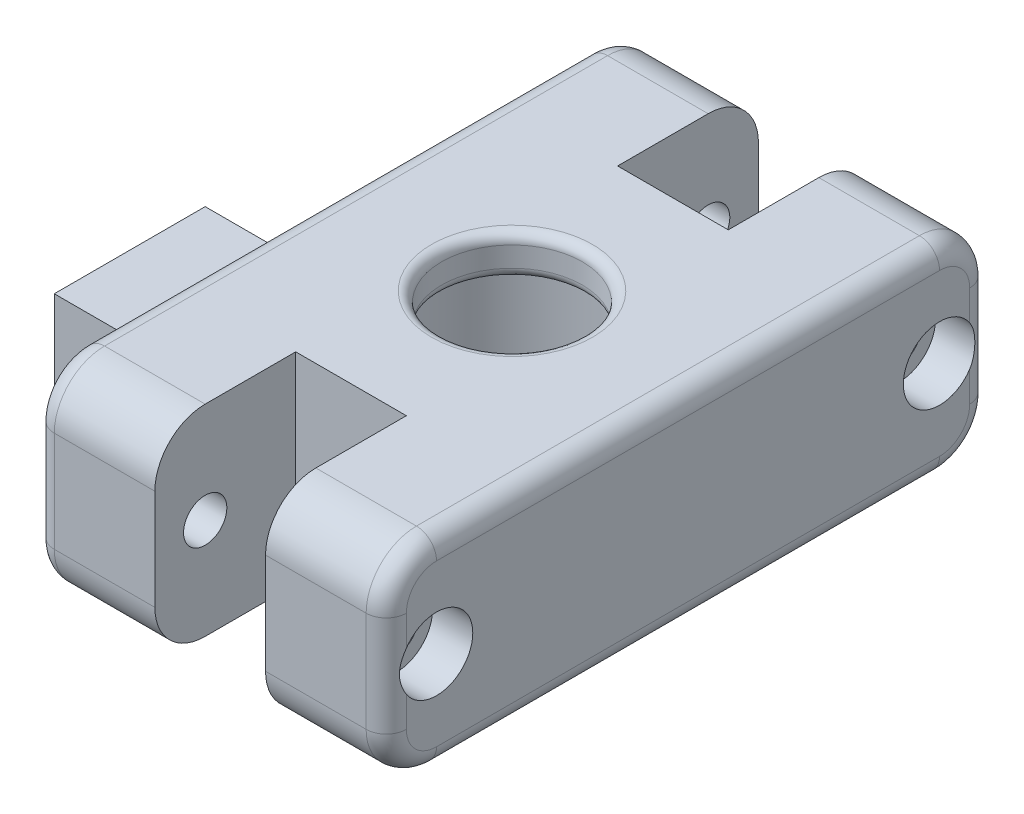
from build123d import *

# Parameters (mm, degrees)
SKETCH1_W           = 35
SKETCH1_H           = 60
BOSS_EXTRUDE1_DEPTH = 20
SKETCH2_R           = 10
CUT_EXTRUDE1_DEPTH  = 16
SKETCH4_R           = 7
CUT_EXTRUDE2_DEPTH  = 42.997755111
FILLET1_R           = 2
SKETCH5_W           = 11
SKETCH5_H           = 14
CUT_EXTRUDE3_DEPTH  = 44.678500826
SKETCH6_R           = 2.15
CUT_EXTRUDE4_DEPTH  = 53.234749007
FILLET3_R           = 5
FILLET4_R           = 5
FILLET7_R           = 1
SKETCH7_W           = 15
SKETCH7_H           = 16
BOSS_EXTRUDE2_DEPTH = 7
SKETCH8_R           = 1.75
CUT_EXTRUDE5_DEPTH  = 15
SKETCH9_R           = 3.6
CUT_EXTRUDE6_DEPTH  = 4
CUT_EXTRUDE7_DEPTH  = 3


with BuildPart() as part:
    # Sketch1 → Boss-Extrude1 (new body)
    with BuildSketch(Plane(origin=(0, 0, 0), x_dir=(1, 0, 0), z_dir=(0, 1, 0))):
        with Locations((-2.608267717, 3.218503937)):
            Rectangle(SKETCH1_W, SKETCH1_H)
    extrude(amount=BOSS_EXTRUDE1_DEPTH)

    # Sketch2 → Cut-Extrude1 (cut)
    with BuildSketch(Plane.XZ):
        with Locations(Location((-2.608267717, -3.218503937, 0), (0, 0, 270))):
            Circle(SKETCH2_R)
    extrude(amount=-CUT_EXTRUDE1_DEPTH, mode=Mode.SUBTRACT)

    # Sketch4 → Cut-Extrude2 (cut, through all)
    with BuildSketch(Plane.XZ.offset(-16)):
        with Locations(Location((-2.608267717, -3.218503937, 0), (0, 0, 270))):
            Circle(SKETCH4_R)
    extrude(amount=-CUT_EXTRUDE2_DEPTH, mode=Mode.SUBTRACT)

    # Fillet1
    fillet1_edges = [part.edges().sort_by_distance(p)[0] for p in [
        (-20.108267717, 20, -3.218503937),
        (14.891732283, 20, -3.218503937),
        (-20.108267717, 0, -3.218503937),
        (14.891732283, 0, -3.218503937),
        (14.891732283, 10, 26.781496063),
        (-20.108267717, 10, 26.781496063),
        (-20.108267717, 10, -33.218503937),
        (14.891732283, 10, -33.218503937),
    ]]
    fillet(fillet1_edges, radius=FILLET1_R)

    # Sketch5 → Cut-Extrude3 (cut, through all)
    with BuildSketch(Plane.XZ):
        with Locations((-2.608267717, 19.781496063)):
            Rectangle(SKETCH5_W, SKETCH5_H)
        with Locations((-2.608267717, -26.218503937)):
            Rectangle(SKETCH5_W, SKETCH5_H)
    extrude(amount=-CUT_EXTRUDE3_DEPTH, mode=Mode.SUBTRACT)

    # Sketch6 → Cut-Extrude4 (cut, through all)
    with BuildSketch(Plane.ZY.offset(20.108267717)):
        with Locations((-28.218503937, 10)):
            Circle(SKETCH6_R)
        with Locations((21.781496063, 10)):
            Circle(SKETCH6_R)
    extrude(amount=-CUT_EXTRUDE4_DEPTH, mode=Mode.SUBTRACT)

    # Fillet3
    # the kernel refuses this fillet: 5 mm, written as the material it takes off along each edge
    with BuildSketch(Plane(origin=(-20.108267717, 15, 21.781496063), x_dir=(0, 0, 1), z_dir=(0, -1, 0))) as fillet3_piece_1:
        with BuildLine():
            CenterArc((3, -2), 2, 0, 90)
            Line((5, -2), (5, 0))
            Line((5, 0), (3, 0))
        make_face()
    revolve(axis=Axis((-20.108267717, 15, 21.781496063), (-1, 0, 0)), revolution_arc=90, mode=Mode.SUBTRACT)
    with BuildSketch(Plane(origin=(-20.108267717, 5, 21.781496063), x_dir=(0, -1, 0), z_dir=(0, 0, -1))) as fillet3_piece_2:
        with BuildLine():
            CenterArc((3, -2), 2, 0, 90)
            Line((5, -2), (5, 0))
            Line((5, 0), (3, 0))
        make_face()
    revolve(axis=Axis((-20.108267717, 5, 21.781496063), (-1, 0, 0)), revolution_arc=90, mode=Mode.SUBTRACT)
    with BuildSketch(Plane(origin=(14.891732283, 15, 21.781496063), x_dir=(0, 1, 0), z_dir=(0, 0, -1))) as fillet3_piece_3:
        with BuildLine():
            CenterArc((3, -2), 2, 0, 90)
            Line((5, -2), (5, 0))
            Line((5, 0), (3, 0))
        make_face()
    revolve(axis=Axis((14.891732283, 15, 21.781496063), (1, 0, 0)), revolution_arc=90, mode=Mode.SUBTRACT)
    with BuildSketch(Plane(origin=(14.891732283, 5, 21.781496063), x_dir=(0, 0, 1), z_dir=(0, 1, 0))) as fillet3_piece_4:
        with BuildLine():
            CenterArc((3, -2), 2, 0, 90)
            Line((5, -2), (5, 0))
            Line((5, 0), (3, 0))
        make_face()
    revolve(axis=Axis((14.891732283, 5, 21.781496063), (1, 0, 0)), revolution_arc=90, mode=Mode.SUBTRACT)
    with BuildSketch(Plane(origin=(4.391732283, 20, 26.781496063), x_dir=(0, 0, -1), z_dir=(-1, 0, 0)), Plane(origin=(14.891732283, 0, 26.781496063), x_dir=(0, 1, 0), z_dir=(-1, 0, 0))) as fillet3_piece_5:
        with BuildLine():
            CenterArc((FILLET3_R, FILLET3_R), FILLET3_R, 180, 90)
            Line((0, FILLET3_R), (0, 0))
            Line((0, 0), (FILLET3_R, 0))
        make_face()
    extrude(amount=24.5, mode=Mode.SUBTRACT)
    with BuildSketch(Plane(origin=(4.391732283, 0, 26.781496063), x_dir=(0, 0, -1), z_dir=(-1, 0, 0)), Plane(origin=(14.891732283, 20, 26.781496063), x_dir=(0, -1, 0), z_dir=(-1, 0, 0))) as fillet3_piece_6:
        with BuildLine():
            CenterArc((FILLET3_R, -FILLET3_R), FILLET3_R, 90, 90)
            Line((0, -FILLET3_R), (0, 0))
            Line((0, 0), (FILLET3_R, 0))
        make_face()
    extrude(amount=24.5, mode=Mode.SUBTRACT)

    # Fillet4
    # the kernel refuses this fillet: 5 mm, written as the material it takes off along each edge
    with BuildSketch(Plane(origin=(-20.108267717, 15, -28.218503937), x_dir=(0, 1, 0), z_dir=(0, 0, 1))) as fillet4_piece_1:
        with BuildLine():
            CenterArc((3, -2), 2, 0, 90)
            Line((5, -2), (5, 0))
            Line((5, 0), (3, 0))
        make_face()
    revolve(axis=Axis((-20.108267717, 15, -28.218503937), (-1, 0, 0)), revolution_arc=90, mode=Mode.SUBTRACT)
    with BuildSketch(Plane(origin=(-20.108267717, 5, -28.218503937), x_dir=(0, 0, -1), z_dir=(0, 1, 0))) as fillet4_piece_2:
        with BuildLine():
            CenterArc((3, -2), 2, 0, 90)
            Line((5, -2), (5, 0))
            Line((5, 0), (3, 0))
        make_face()
    revolve(axis=Axis((-20.108267717, 5, -28.218503937), (-1, 0, 0)), revolution_arc=90, mode=Mode.SUBTRACT)
    with BuildSketch(Plane(origin=(14.891732283, 15, -28.218503937), x_dir=(0, 0, -1), z_dir=(0, -1, 0))) as fillet4_piece_3:
        with BuildLine():
            CenterArc((3, -2), 2, 0, 90)
            Line((5, -2), (5, 0))
            Line((5, 0), (3, 0))
        make_face()
    revolve(axis=Axis((14.891732283, 15, -28.218503937), (1, 0, 0)), revolution_arc=90, mode=Mode.SUBTRACT)
    with BuildSketch(Plane(origin=(14.891732283, 5, -28.218503937), x_dir=(0, -1, 0), z_dir=(0, 0, 1))) as fillet4_piece_4:
        with BuildLine():
            CenterArc((3, -2), 2, 0, 90)
            Line((5, -2), (5, 0))
            Line((5, 0), (3, 0))
        make_face()
    revolve(axis=Axis((14.891732283, 5, -28.218503937), (1, 0, 0)), revolution_arc=90, mode=Mode.SUBTRACT)
    with BuildSketch(Plane(origin=(-9.608267717, 0, -33.218503937), x_dir=(0, 1, 0), z_dir=(1, 0, 0)), Plane(origin=(-20.108267717, 0, -33.218503937), x_dir=(0, 1, 0), z_dir=(1, 0, 0))) as fillet4_piece_5:
        with BuildLine():
            CenterArc((FILLET4_R, FILLET4_R), FILLET4_R, 180, 90)
            Line((0, FILLET4_R), (0, 0))
            Line((0, 0), (FILLET4_R, 0))
        make_face()
    extrude(amount=24.5, mode=Mode.SUBTRACT)
    with BuildSketch(Plane(origin=(-9.608267717, 20, -33.218503937), x_dir=(0, -1, 0), z_dir=(1, 0, 0)), Plane(origin=(-20.108267717, 20, -33.218503937), x_dir=(0, -1, 0), z_dir=(1, 0, 0))) as fillet4_piece_6:
        with BuildLine():
            CenterArc((FILLET4_R, -FILLET4_R), FILLET4_R, 90, 90)
            Line((0, -FILLET4_R), (0, 0))
            Line((0, 0), (FILLET4_R, 0))
        make_face()
    extrude(amount=24.5, mode=Mode.SUBTRACT)

    # Fillet7
    fillet7_edges = [part.edges().sort_by_distance(p)[0] for p in [
        (-2.608267717, 20, 3.781496063),
        (-2.608267717, 16, 3.781496063),
    ]]
    fillet(fillet7_edges, radius=FILLET7_R)

    # Sketch7 → Boss-Extrude2 (add)
    with BuildSketch(Plane.ZY.offset(20.108267717)):
        with Locations((10.281496063, 10)):
            Rectangle(SKETCH7_W, SKETCH7_H)
    extrude(amount=BOSS_EXTRUDE2_DEPTH)

    # Sketch8 → Cut-Extrude5 (cut)
    with BuildSketch(Plane.ZY.offset(27.108267717)):
        with Locations((13.781496063, 14)):
            Circle(SKETCH8_R)
    extrude(amount=-CUT_EXTRUDE5_DEPTH, mode=Mode.SUBTRACT)

    # Sketch9 → Cut-Extrude6 (cut)
    with BuildSketch(Plane(origin=(14.891732283, 0, 0), x_dir=(0, 0, -1), z_dir=(1, 0, 0))):
        with Locations((-21.781496063, 10)):
            Circle(SKETCH9_R)
        with Locations((28.218503937, 10)):
            Circle(SKETCH9_R)
    extrude(amount=-CUT_EXTRUDE6_DEPTH, mode=Mode.SUBTRACT)

    # Sketch10 → Cut-Extrude7 (cut)
    with BuildSketch(Plane.ZY.offset(20.108267717)):
        Polygon((23.74867671, 6.403677763), (25.879592804, 9.905467295), (23.912412157, 13.501789533), (19.814315416, 13.596322237), (17.683399322, 10.094532705), (19.650579969, 6.498210467), align=None)
        Polygon((-24.647931539, 7.986459316), (-24.689440355, 12.085436061), (-28.260012753, 14.098976744), (-31.789076335, 12.013540684), (-31.747567519, 7.914563939), (-28.176995122, 5.901023256), align=None)
    extrude(amount=-CUT_EXTRUDE7_DEPTH, mode=Mode.SUBTRACT)


solid = part.part
